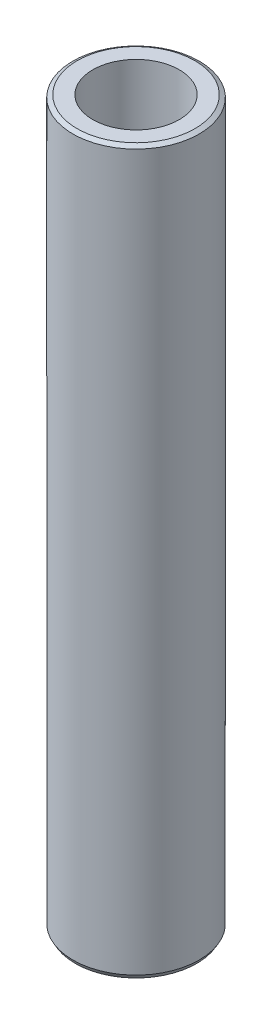
from build123d import *
from OCP.BRepFilletAPI import BRepFilletAPI_MakeChamfer

# Parameters (mm, degrees)
SKETCH1_R           = 52.5
BOSS_EXTRUDE1_DEPTH = 600
SKETCH2_R           = 35.928327364
CUT_EXTRUDE1_DEPTH  = 605.576297914
CHAMFER1_SIZE       = 2.05251495
CHAMFER1_SIZE2      = 3.555060176


with BuildPart() as part:
    # Sketch1 → Boss-Extrude1 (new body)
    with BuildSketch(Plane(origin=(0, 0, 0), x_dir=(1, 0, 0), z_dir=(0, 1, 0))):
        Circle(SKETCH1_R)
    extrude(amount=BOSS_EXTRUDE1_DEPTH)

    # Sketch2 → Cut-Extrude1 (cut, through all)
    with BuildSketch(Plane(origin=(0, 0, 0), x_dir=(1, 0, 0), z_dir=(0, 1, 0))):
        Circle(SKETCH2_R)
    extrude(amount=CUT_EXTRUDE1_DEPTH, mode=Mode.SUBTRACT)

    # Chamfer1: one chamfer whose edges measure the first distance from different faces: ONE call of the kernel's chamfer builder (chamfer() names one face for all edges)
    chamfer1_edges_1 = [part.edges().sort_by_distance(p)[0] for p in [
        (-52.5, 600, 0),
    ]]
    chamfer1_side_1 = [part.faces().sort_by_distance(p)[0] for p in [
        (-52.5, 300, 0),
    ]]
    chamfer1_edges_2 = [part.edges().sort_by_distance(p)[0] for p in [
        (-52.5, 0, 0),
    ]]
    chamfer1_side_2 = [part.faces().sort_by_distance(p)[0] for p in [
        (-51.01507576, 0, 0),
    ]]
    chamfer1 = BRepFilletAPI_MakeChamfer(part.part.solid().wrapped)
    for e in chamfer1_edges_1:
        chamfer1.Add(CHAMFER1_SIZE, CHAMFER1_SIZE2, e.wrapped, chamfer1_side_1[0].wrapped)  # the first distance lies on this face
    for e in chamfer1_edges_2:
        chamfer1.Add(CHAMFER1_SIZE, CHAMFER1_SIZE2, e.wrapped, chamfer1_side_2[0].wrapped)  # the first distance lies on this face
    add(Compound.cast(chamfer1.Shape()), mode=Mode.REPLACE)


solid = part.part
